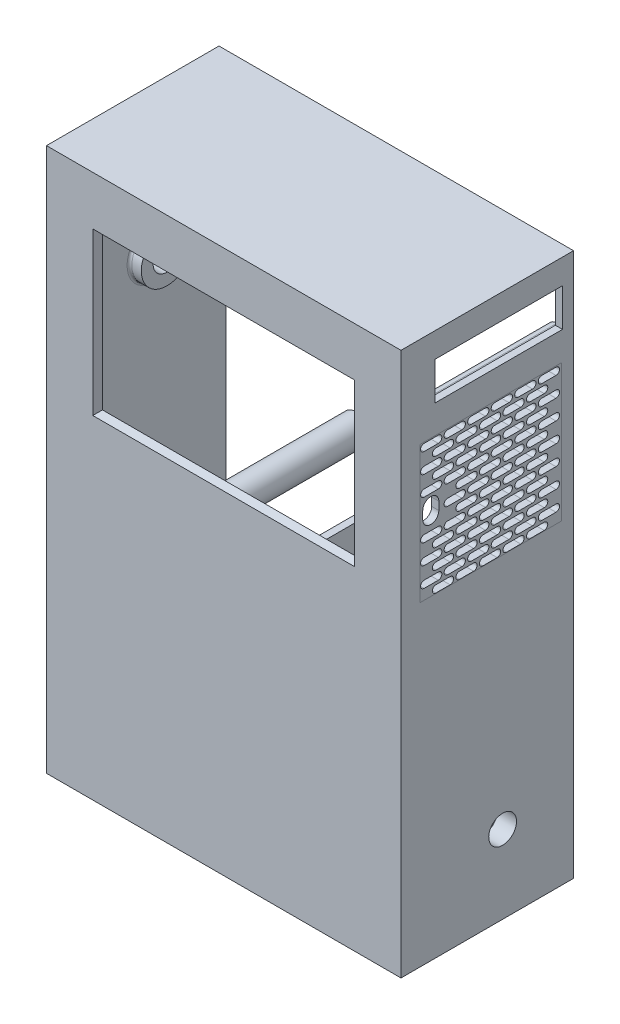
from build123d import *

# Parameters (mm, degrees)
SKETCH1_W                          = 150
SKETCH1_H                          = 230
OUTER_CASE_DEPTH                   = 73
CASE_THICKNESS_T                   = -3
SKETCH4_W                          = 108.6
SKETCH4_H                          = 66.2
DISPLAY_CUTOUT_DEPTH               = 155.110350074
DISPLAY_CUTOUT_TAPER               = -20
SKETCH5_W                          = 3
SKETCH5_H                          = 27.5
VALVE_SUPPORTER_DEPTH              = 30
SKETCH19_W                         = 2
SKETCH19_H                         = 27.5
VALVE_STOPPER_DEPTH                = 4.5
SKETCH7_R                          = 3.75
DISPLAY_MOUNT_DEPTH                = 6.2
DISPLAY_MOUNT_TAP_D                = 2.05
DISPLAY_MOUNT_TAP_DEPTH            = 5.7
DISPLAY_MOUNT_TAP_TIP              = 0.615882135
SKETCH13_R                         = 5.875
INLET_DEPTH                        = 201.40708587
INLET_START                        = 5
SKETCH14_R                         = 10.875
SKETCH14_R_2                       = 5.875
INLET_SUPPORT_DEPTH                = 5
SKETCH16_R                         = 3.5
RPI_MOUNT_DEPTH                    = 6
RPI_MOUNT_TAP_D                    = 2.05
RPI_MOUNT_TAP_DEPTH                = 5.5
RPI_MOUNT_TAP_TIP                  = 0.615882135
SKETCH18_W                         = 54
SKETCH18_H                         = 16
RPI_CUTOUT_DEPTH                   = 201.40708587
CUT_EXTRUDE1_REACH                 = 202.407
VENT_SEED_REACH                    = 204.618
VENT_START                         = 72
VENT_PATTERN_DEPTH                 = 3
SKETCH22_W                         = 15.5
SKETCH22_H                         = 21.9
LA_MOUNT_DEPTH                     = 24
LA_START                           = -3
SKETCH23_W                         = 24
SKETCH23_H                         = 21.9
LA_SLOT_DEPTH                      = 9.5
DISPLAY_SCREW_PASSTHROUGH_REACH    = 145.649
SKETCH24_R                         = 2.5
LA_PINHOLE_REACH                   = 145.649
SKETCH25_R                         = 2
LA_MOUNT_SUPPORT_REACH             = 156.11
LA_MOUNT_FILLET_R                  = 1
CORNER_START                       = -70
SKETCH26_W                         = 8
SKETCH26_H                         = 8
CORNER_SUPPORT_DEPTH               = 70
SKETCH40_R                         = 6
CETER_SUPPORT_DEPTH                = 70
SUPPORT_FILLET_R                   = 4
LA_SUPPORT_DEPTH                   = 10
TAP_DRILL_FOR_M2_5X0_45_TAP3_D     = 2.05
TAP_DRILL_FOR_M2_5X0_45_TAP3_DEPTH = 9.5
TAP_DRILL_FOR_M2_5X0_45_TAP3_TIP   = 0.615882135
SKETCH32_R                         = 5.875
OUTLET_DEPTH                       = 3
OUTLET_START                       = 5
SKETCH34_R                         = 10.875
SKETCH34_R_2                       = 5.875
OUTLET_SUPPORT_DEPTH               = 5
GENERAL_FILLET_R                   = 1
TAP_DRILL_FOR_M2_5X0_45_TAP5_D     = 2.05
TAP_DRILL_FOR_M2_5X0_45_TAP5_DEPTH = 30
TAP_DRILL_FOR_M2_5X0_45_TAP5_TIP   = 0.615882135


# Read off the part's stored shape, not the designer's step: Vent Pattern
# Some blends are built 0.0001 mm under size
with BuildPart() as part:
    # Sketch1 → Outer Case (new body)
    with BuildSketch(Plane.XY):
        Rectangle(SKETCH1_W, SKETCH1_H)
    extrude(amount=OUTER_CASE_DEPTH)

    # Case Thickness
    case_thickness_openings = [part.faces().sort_by_distance(p)[0] for p in [
        (0, 0, 0),
    ]]
    offset(amount=CASE_THICKNESS_T, openings=case_thickness_openings, kind=Kind.INTERSECTION)

    # Sketch4 → Display Cutout (cut, through all)
    with BuildSketch(Plane(origin=(0, 0, 70), x_dir=(-1, 0, 0), z_dir=(0, 0, -1))):
        with Locations((0, 60.1)):
            Rectangle(SKETCH4_W, SKETCH4_H)
    extrude(amount=-DISPLAY_CUTOUT_DEPTH, taper=DISPLAY_CUTOUT_TAPER, mode=Mode.SUBTRACT)

    # Sketch5 → Valve Supporter (add)
    with BuildSketch(Plane(origin=(0, 0, 70), x_dir=(-1, 0, 0), z_dir=(0, 0, -1))):
        with Locations((-48.5, -2.25)):
            Rectangle(SKETCH5_W, SKETCH5_H)
        with Locations((-23.5, -2.25)):
            Rectangle(SKETCH5_W, SKETCH5_H)
    extrude(amount=VALVE_SUPPORTER_DEPTH)

    # Sketch19 → Valve Stopper (add)
    with BuildSketch(Plane(origin=(0, 0, 70), x_dir=(-1, 0, 0), z_dir=(0, 0, -1))):
        with Locations((-66.5, -2.25)):
            Rectangle(SKETCH19_W, SKETCH19_H)
        with Locations((-41.5, -2.25)):
            Rectangle(SKETCH19_W, SKETCH19_H)
    extrude(amount=VALVE_STOPPER_DEPTH)

    # Sketch7 → Display Mount (add)
    with BuildSketch(Plane(origin=(0, 0, 70), x_dir=(-1, 0, 0), z_dir=(0, 0, -1))):
        with Locations(Location((-56.35, 99.9, 0), (0, 0, 180))):
            Circle(SKETCH7_R)
        with Locations(Location((56.35, 99.9, 0), (0, 0, 180))):
            Circle(SKETCH7_R)
        with Locations(Location((56.35, 16.1, 0), (0, 0, 180))):
            Circle(SKETCH7_R)
        with Locations(Location((-56.35, 16.1, 0), (0, 0, 180))):
            Circle(SKETCH7_R)
    extrude(amount=DISPLAY_MOUNT_DEPTH)

    # Display Mount Tap
    with Locations(Plane(origin=(56.35, 99.9, 63.8), x_dir=(-1, 0, 0), z_dir=(0, 0, -1))):
        with Locations((0, 0), (112.7, 0), (0, -83.8), (112.7, -83.8)):
            Hole(DISPLAY_MOUNT_TAP_D / 2, depth=DISPLAY_MOUNT_TAP_DEPTH)
            with Locations((0, 0, -(DISPLAY_MOUNT_TAP_DEPTH + DISPLAY_MOUNT_TAP_TIP / 2))):  # 118° drill point
                Cone(0, DISPLAY_MOUNT_TAP_D / 2, DISPLAY_MOUNT_TAP_TIP, mode=Mode.SUBTRACT)

    # Sketch13 → Inlet (cut, through all)
    with BuildSketch(Plane.ZY.offset(-72)):
        with Locations(Location((30, -82, 0), (0, 0, 270))):
            Circle(SKETCH13_R)
    extrude(amount=-INLET_DEPTH, mode=Mode.SUBTRACT)

    # Sketch14 → Inlet Support (add)
    with BuildSketch(Plane.ZY.offset(-72).offset(INLET_START)):
        with Locations((30, -82)):
            Circle(SKETCH14_R)
        with Locations((30, -82)):
            Circle(SKETCH14_R_2, mode=Mode.SUBTRACT)
    extrude(amount=-INLET_SUPPORT_DEPTH)

    # Sketch16 → RPi Mount (add)
    with BuildSketch(Plane.XZ.offset(-112)):
        with Locations(Location((47.5, 7, 0), (0, 0, 270))):
            Circle(SKETCH16_R)
        with Locations(Location((-10.5, 7, 0), (0, 0, 270))):
            Circle(SKETCH16_R)
        with Locations(Location((-10.5, 56, 0), (0, 0, 270))):
            Circle(SKETCH16_R)
        with Locations(Location((47.5, 56, 0), (0, 0, 270))):
            Circle(SKETCH16_R)
    extrude(amount=RPI_MOUNT_DEPTH)

    # RPi Mount Tap
    with Locations(Plane(origin=(47.5, 106, 7), x_dir=(0, 0, -1), z_dir=(0, -1, 0))):
        with Locations((0, 0), (-49, 0), (0, -58), (-49, -58)):
            Hole(RPI_MOUNT_TAP_D / 2, depth=RPI_MOUNT_TAP_DEPTH)
            with Locations((0, 0, -(RPI_MOUNT_TAP_DEPTH + RPI_MOUNT_TAP_TIP / 2))):  # 118° drill point
                Cone(0, RPI_MOUNT_TAP_D / 2, RPI_MOUNT_TAP_TIP, mode=Mode.SUBTRACT)

    # Sketch18 → RPi Cutout (cut, through all)
    with BuildSketch(Plane.ZY.offset(-72)):
        with Locations((31.675, 96.5)):
            Rectangle(SKETCH18_W, SKETCH18_H)
    extrude(amount=-RPI_CUTOUT_DEPTH, mode=Mode.SUBTRACT)

    # Sketch44 → Cut-Extrude1 (cut, up to next)
    with BuildSketch(Plane.ZY.offset(-72), mode=Mode.PRIVATE) as cut_extrude1_sk1:
        with BuildLine():
            Line((57, 48.3), (57, 51.7))
            ThreePointArc((57, 51.7), (60.4, 55.1), (63.8, 51.7))
            Line((63.8, 51.7), (63.8, 48.3))
            ThreePointArc((63.8, 48.3), (60.4, 44.9), (57, 48.3))
        make_face()
    cut_extrude1_tool1 = extrude(cut_extrude1_sk1.sketch, amount=-CUT_EXTRUDE1_REACH, mode=Mode.PRIVATE) & part.part
    add(cut_extrude1_tool1.solids().sort_by_distance((72, 50, 60.4))[0], mode=Mode.SUBTRACT)

    # Sketch21 → Vent Seed (cut, up to next)
    with BuildSketch(Plane(origin=(75, 0, 0), x_dir=(0, 0, -1), z_dir=(1, 0, 0)), mode=Mode.PRIVATE) as vent_seed_sk1:
        with BuildLine():
            Line((-63.21410267, 76.012960927), (-57.21410267, 76.012960927))
            ThreePointArc((-57.21410267, 76.012960927), (-55.71410267, 74.512960927), (-57.21410267, 73.012960927))
            Line((-57.21410267, 73.012960927), (-63.21410267, 73.012960927))
            ThreePointArc((-63.21410267, 73.012960927), (-64.71410267, 74.512960927), (-63.21410267, 76.012960927))
        make_face()
    vent_seed_tool1 = extrude(vent_seed_sk1.sketch, amount=-VENT_SEED_REACH, mode=Mode.PRIVATE) & part.part
    add(vent_seed_tool1.solids().sort_by_distance((75, 74.512961, 60.214103))[0], mode=Mode.SUBTRACT)

    # Vent Pattern outline → Vent Pattern (cut)
    with BuildSketch(Plane.YZ.offset(VENT_START)):
        with BuildLine():
            ThreePointArc((73.012960927, 47.25552491), (74.512960927, 45.75552491), (76.012960927, 47.25552491))
            Line((76.012960927, 47.25552491), (76.012960927, 53.25552491))
            ThreePointArc((76.012960927, 53.25552491), (74.512960927, 54.75552491), (73.012960927, 53.25552491))
            Line((73.012960927, 53.25552491), (73.012960927, 47.25552491))
        make_face()
        with BuildLine():
            ThreePointArc((73.012960927, 7.421213867), (74.512960927, 5.921213867), (76.012960927, 7.421213867))
            Line((76.012960927, 7.421213867), (76.012960927, 13.421213867))
            ThreePointArc((76.012960927, 13.421213867), (74.512960927, 14.921213867), (73.012960927, 13.421213867))
            Line((73.012960927, 13.421213867), (73.012960927, 7.421213867))
        make_face()
        with BuildLine():
            ThreePointArc((73.012960927, 27.338369388), (74.512960927, 25.838369388), (76.012960927, 27.338369388))
            Line((76.012960927, 27.338369388), (76.012960927, 33.338369388))
            ThreePointArc((76.012960927, 33.338369388), (74.512960927, 34.838369388), (73.012960927, 33.338369388))
            Line((73.012960927, 33.338369388), (73.012960927, 27.338369388))
        make_face()
        with BuildLine():
            ThreePointArc((73.012960927, 37.296947149), (74.512960927, 35.796947149), (76.012960927, 37.296947149))
            Line((76.012960927, 37.296947149), (76.012960927, 43.296947149))
            ThreePointArc((76.012960927, 43.296947149), (74.512960927, 44.796947149), (73.012960927, 43.296947149))
            Line((73.012960927, 43.296947149), (73.012960927, 37.296947149))
        make_face()
        with BuildLine():
            ThreePointArc((73.012960927, 17.379791628), (74.512960927, 15.879791628), (76.012960927, 17.379791628))
            Line((76.012960927, 17.379791628), (76.012960927, 23.379791628))
            ThreePointArc((76.012960927, 23.379791628), (74.512960927, 24.879791628), (73.012960927, 23.379791628))
            Line((73.012960927, 23.379791628), (73.012960927, 17.379791628))
        make_face()
        with BuildLine():
            Line((25.875527372, 27.338369388), (25.875527372, 33.338369388))
            ThreePointArc((25.875527372, 33.338369388), (24.375527372, 34.838369388), (22.875527372, 33.338369388))
            Line((22.875527372, 33.338369388), (22.875527372, 27.338369388))
            ThreePointArc((22.875527372, 27.338369388), (24.375527372, 25.838369388), (25.875527372, 27.338369388))
        make_face()
        with BuildLine():
            ThreePointArc((22.875527372, 7.421213867), (24.375527372, 5.921213867), (25.875527372, 7.421213867))
            Line((25.875527372, 7.421213867), (25.875527372, 13.421213867))
            ThreePointArc((25.875527372, 13.421213867), (24.375527372, 14.921213867), (22.875527372, 13.421213867))
            Line((22.875527372, 13.421213867), (22.875527372, 7.421213867))
        make_face()
        with BuildLine():
            ThreePointArc((22.875527372, 17.379791628), (24.375527372, 15.879791628), (25.875527372, 17.379791628))
            Line((25.875527372, 17.379791628), (25.875527372, 23.379791628))
            ThreePointArc((25.875527372, 23.379791628), (24.375527372, 24.879791628), (22.875527372, 23.379791628))
            Line((22.875527372, 23.379791628), (22.875527372, 17.379791628))
        make_face()
        with BuildLine():
            ThreePointArc((22.875527372, 47.25552491), (24.375527372, 45.75552491), (25.875527372, 47.25552491))
            Line((25.875527372, 47.25552491), (25.875527372, 53.25552491))
            ThreePointArc((25.875527372, 53.25552491), (24.375527372, 54.75552491), (22.875527372, 53.25552491))
            Line((22.875527372, 53.25552491), (22.875527372, 47.25552491))
        make_face()
        with BuildLine():
            ThreePointArc((22.875527372, 37.296947149), (24.375527372, 35.796947149), (25.875527372, 37.296947149))
            Line((25.875527372, 37.296947149), (25.875527372, 43.296947149))
            ThreePointArc((25.875527372, 43.296947149), (24.375527372, 44.796947149), (22.875527372, 43.296947149))
            Line((22.875527372, 43.296947149), (22.875527372, 37.296947149))
        make_face()
        with BuildLine():
            ThreePointArc((22.875527372, 57.21410267), (24.375527372, 55.71410267), (25.875527372, 57.21410267))
            Line((25.875527372, 57.21410267), (25.875527372, 63.21410267))
            ThreePointArc((25.875527372, 63.21410267), (24.375527372, 64.71410267), (22.875527372, 63.21410267))
            Line((22.875527372, 63.21410267), (22.875527372, 57.21410267))
        make_face()
        with BuildLine():
            Line((21.697407909, 32.317658269), (21.697407909, 38.317658269))
            ThreePointArc((21.697407909, 38.317658269), (20.197407909, 39.817658269), (18.697407909, 38.317658269))
            Line((18.697407909, 38.317658269), (18.697407909, 32.317658269))
            ThreePointArc((18.697407909, 32.317658269), (20.197407909, 30.817658269), (21.697407909, 32.317658269))
        make_face()
        with BuildLine():
            ThreePointArc((18.697407909, 12.400502748), (20.197407909, 10.900502748), (21.697407909, 12.400502748))
            Line((21.697407909, 12.400502748), (21.697407909, 18.400502748))
            ThreePointArc((21.697407909, 18.400502748), (20.197407909, 19.900502748), (18.697407909, 18.400502748))
            Line((18.697407909, 18.400502748), (18.697407909, 12.400502748))
        make_face()
        with BuildLine():
            ThreePointArc((18.697407909, 22.359080508), (20.197407909, 20.859080508), (21.697407909, 22.359080508))
            Line((21.697407909, 22.359080508), (21.697407909, 28.359080508))
            ThreePointArc((21.697407909, 28.359080508), (20.197407909, 29.859080508), (18.697407909, 28.359080508))
            Line((18.697407909, 28.359080508), (18.697407909, 22.359080508))
        make_face()
        with BuildLine():
            ThreePointArc((18.697407909, 52.23481379), (20.197407909, 50.73481379), (21.697407909, 52.23481379))
            Line((21.697407909, 52.23481379), (21.697407909, 58.23481379))
            ThreePointArc((21.697407909, 58.23481379), (20.197407909, 59.73481379), (18.697407909, 58.23481379))
            Line((18.697407909, 58.23481379), (18.697407909, 52.23481379))
        make_face()
        with BuildLine():
            ThreePointArc((18.697407909, 42.276236029), (20.197407909, 40.776236029), (21.697407909, 42.276236029))
            Line((21.697407909, 42.276236029), (21.697407909, 48.276236029))
            ThreePointArc((21.697407909, 48.276236029), (20.197407909, 49.776236029), (18.697407909, 48.276236029))
            Line((18.697407909, 48.276236029), (18.697407909, 42.276236029))
        make_face()
        with BuildLine():
            Line((34.231766298, 7.421213867), (34.231766298, 13.421213867))
            ThreePointArc((34.231766298, 13.421213867), (32.731766298, 14.921213867), (31.231766298, 13.421213867))
            Line((31.231766298, 13.421213867), (31.231766298, 7.421213867))
            ThreePointArc((31.231766298, 7.421213867), (32.731766298, 5.921213867), (34.231766298, 7.421213867))
        make_face()
        with BuildLine():
            ThreePointArc((31.231766298, 57.21410267), (32.731766298, 55.71410267), (34.231766298, 57.21410267))
            Line((34.231766298, 57.21410267), (34.231766298, 63.21410267))
            ThreePointArc((34.231766298, 63.21410267), (32.731766298, 64.71410267), (31.231766298, 63.21410267))
            Line((31.231766298, 63.21410267), (31.231766298, 57.21410267))
        make_face()
        with BuildLine():
            ThreePointArc((31.231766298, 37.296947149), (32.731766298, 35.796947149), (34.231766298, 37.296947149))
            Line((34.231766298, 37.296947149), (34.231766298, 43.296947149))
            ThreePointArc((34.231766298, 43.296947149), (32.731766298, 44.796947149), (31.231766298, 43.296947149))
            Line((31.231766298, 43.296947149), (31.231766298, 37.296947149))
        make_face()
        with BuildLine():
            ThreePointArc((31.231766298, 17.379791628), (32.731766298, 15.879791628), (34.231766298, 17.379791628))
            Line((34.231766298, 17.379791628), (34.231766298, 23.379791628))
            ThreePointArc((34.231766298, 23.379791628), (32.731766298, 24.879791628), (31.231766298, 23.379791628))
            Line((31.231766298, 23.379791628), (31.231766298, 17.379791628))
        make_face()
        with BuildLine():
            ThreePointArc((31.231766298, 27.338369388), (32.731766298, 25.838369388), (34.231766298, 27.338369388))
            Line((34.231766298, 27.338369388), (34.231766298, 33.338369388))
            ThreePointArc((34.231766298, 33.338369388), (32.731766298, 34.838369388), (31.231766298, 33.338369388))
            Line((31.231766298, 33.338369388), (31.231766298, 27.338369388))
        make_face()
        with BuildLine():
            ThreePointArc((31.231766298, 47.25552491), (32.731766298, 45.75552491), (34.231766298, 47.25552491))
            Line((34.231766298, 47.25552491), (34.231766298, 53.25552491))
            ThreePointArc((34.231766298, 53.25552491), (32.731766298, 54.75552491), (31.231766298, 53.25552491))
            Line((31.231766298, 53.25552491), (31.231766298, 47.25552491))
        make_face()
        with BuildLine():
            Line((30.053646835, 12.400502748), (30.053646835, 18.400502748))
            ThreePointArc((30.053646835, 18.400502748), (28.553646835, 19.900502748), (27.053646835, 18.400502748))
            Line((27.053646835, 18.400502748), (27.053646835, 12.400502748))
            ThreePointArc((27.053646835, 12.400502748), (28.553646835, 10.900502748), (30.053646835, 12.400502748))
        make_face()
        with BuildLine():
            ThreePointArc((27.053646835, 42.276236029), (28.553646835, 40.776236029), (30.053646835, 42.276236029))
            Line((30.053646835, 42.276236029), (30.053646835, 48.276236029))
            ThreePointArc((30.053646835, 48.276236029), (28.553646835, 49.776236029), (27.053646835, 48.276236029))
            Line((27.053646835, 48.276236029), (27.053646835, 42.276236029))
        make_face()
        with BuildLine():
            ThreePointArc((27.053646835, 22.359080508), (28.553646835, 20.859080508), (30.053646835, 22.359080508))
            Line((30.053646835, 22.359080508), (30.053646835, 28.359080508))
            ThreePointArc((30.053646835, 28.359080508), (28.553646835, 29.859080508), (27.053646835, 28.359080508))
            Line((27.053646835, 28.359080508), (27.053646835, 22.359080508))
        make_face()
        with BuildLine():
            ThreePointArc((27.053646835, 32.317658269), (28.553646835, 30.817658269), (30.053646835, 32.317658269))
            Line((30.053646835, 32.317658269), (30.053646835, 38.317658269))
            ThreePointArc((30.053646835, 38.317658269), (28.553646835, 39.817658269), (27.053646835, 38.317658269))
            Line((27.053646835, 38.317658269), (27.053646835, 32.317658269))
        make_face()
        with BuildLine():
            ThreePointArc((27.053646835, 52.23481379), (28.553646835, 50.73481379), (30.053646835, 52.23481379))
            Line((30.053646835, 52.23481379), (30.053646835, 58.23481379))
            ThreePointArc((30.053646835, 58.23481379), (28.553646835, 59.73481379), (27.053646835, 58.23481379))
            Line((27.053646835, 58.23481379), (27.053646835, 52.23481379))
        make_face()
        with BuildLine():
            Line((59.300483076, 37.296947149), (59.300483076, 43.296947149))
            ThreePointArc((59.300483076, 43.296947149), (57.800483076, 44.796947149), (56.300483076, 43.296947149))
            Line((56.300483076, 43.296947149), (56.300483076, 37.296947149))
            ThreePointArc((56.300483076, 37.296947149), (57.800483076, 35.796947149), (59.300483076, 37.296947149))
        make_face()
        with BuildLine():
            ThreePointArc((56.300483076, 27.338369388), (57.800483076, 25.838369388), (59.300483076, 27.338369388))
            Line((59.300483076, 27.338369388), (59.300483076, 33.338369388))
            ThreePointArc((59.300483076, 33.338369388), (57.800483076, 34.838369388), (56.300483076, 33.338369388))
            Line((56.300483076, 33.338369388), (56.300483076, 27.338369388))
        make_face()
        with BuildLine():
            ThreePointArc((56.300483076, 57.21410267), (57.800483076, 55.71410267), (59.300483076, 57.21410267))
            Line((59.300483076, 57.21410267), (59.300483076, 63.21410267))
            ThreePointArc((59.300483076, 63.21410267), (57.800483076, 64.71410267), (56.300483076, 63.21410267))
            Line((56.300483076, 63.21410267), (56.300483076, 57.21410267))
        make_face()
        with BuildLine():
            ThreePointArc((56.300483076, 47.25552491), (57.800483076, 45.75552491), (59.300483076, 47.25552491))
            Line((59.300483076, 47.25552491), (59.300483076, 53.25552491))
            ThreePointArc((59.300483076, 53.25552491), (57.800483076, 54.75552491), (56.300483076, 53.25552491))
            Line((56.300483076, 53.25552491), (56.300483076, 47.25552491))
        make_face()
        with BuildLine():
            ThreePointArc((56.300483076, 17.379791628), (57.800483076, 15.879791628), (59.300483076, 17.379791628))
            Line((59.300483076, 17.379791628), (59.300483076, 23.379791628))
            ThreePointArc((59.300483076, 23.379791628), (57.800483076, 24.879791628), (56.300483076, 23.379791628))
            Line((56.300483076, 23.379791628), (56.300483076, 17.379791628))
        make_face()
        with BuildLine():
            ThreePointArc((56.300483076, 7.421213867), (57.800483076, 5.921213867), (59.300483076, 7.421213867))
            Line((59.300483076, 7.421213867), (59.300483076, 13.421213867))
            ThreePointArc((59.300483076, 13.421213867), (57.800483076, 14.921213867), (56.300483076, 13.421213867))
            Line((56.300483076, 13.421213867), (56.300483076, 7.421213867))
        make_face()
        with BuildLine():
            Line((55.122363613, 42.276236029), (55.122363613, 48.276236029))
            ThreePointArc((55.122363613, 48.276236029), (53.622363613, 49.776236029), (52.122363613, 48.276236029))
            Line((52.122363613, 48.276236029), (52.122363613, 42.276236029))
            ThreePointArc((52.122363613, 42.276236029), (53.622363613, 40.776236029), (55.122363613, 42.276236029))
        make_face()
        with BuildLine():
            ThreePointArc((52.122363613, 32.317658269), (53.622363613, 30.817658269), (55.122363613, 32.317658269))
            Line((55.122363613, 32.317658269), (55.122363613, 38.317658269))
            ThreePointArc((55.122363613, 38.317658269), (53.622363613, 39.817658269), (52.122363613, 38.317658269))
            Line((52.122363613, 38.317658269), (52.122363613, 32.317658269))
        make_face()
        with BuildLine():
            ThreePointArc((52.122363613, 22.359080508), (53.622363613, 20.859080508), (55.122363613, 22.359080508))
            Line((55.122363613, 22.359080508), (55.122363613, 28.359080508))
            ThreePointArc((55.122363613, 28.359080508), (53.622363613, 29.859080508), (52.122363613, 28.359080508))
            Line((52.122363613, 28.359080508), (52.122363613, 22.359080508))
        make_face()
        with BuildLine():
            ThreePointArc((52.122363613, 12.400502748), (53.622363613, 10.900502748), (55.122363613, 12.400502748))
            Line((55.122363613, 12.400502748), (55.122363613, 18.400502748))
            ThreePointArc((55.122363613, 18.400502748), (53.622363613, 19.900502748), (52.122363613, 18.400502748))
            Line((52.122363613, 18.400502748), (52.122363613, 12.400502748))
        make_face()
        with BuildLine():
            Line((50.94424415, 47.25552491), (50.94424415, 53.25552491))
            ThreePointArc((50.94424415, 53.25552491), (49.44424415, 54.75552491), (47.94424415, 53.25552491))
            Line((47.94424415, 53.25552491), (47.94424415, 47.25552491))
            ThreePointArc((47.94424415, 47.25552491), (49.44424415, 45.75552491), (50.94424415, 47.25552491))
        make_face()
        with BuildLine():
            ThreePointArc((47.94424415, 37.296947149), (49.44424415, 35.796947149), (50.94424415, 37.296947149))
            Line((50.94424415, 37.296947149), (50.94424415, 43.296947149))
            ThreePointArc((50.94424415, 43.296947149), (49.44424415, 44.796947149), (47.94424415, 43.296947149))
            Line((47.94424415, 43.296947149), (47.94424415, 37.296947149))
        make_face()
        with BuildLine():
            ThreePointArc((47.94424415, 7.421213867), (49.44424415, 5.921213867), (50.94424415, 7.421213867))
            Line((50.94424415, 7.421213867), (50.94424415, 13.421213867))
            ThreePointArc((50.94424415, 13.421213867), (49.44424415, 14.921213867), (47.94424415, 13.421213867))
            Line((47.94424415, 13.421213867), (47.94424415, 7.421213867))
        make_face()
        with BuildLine():
            ThreePointArc((47.94424415, 27.338369388), (49.44424415, 25.838369388), (50.94424415, 27.338369388))
            Line((50.94424415, 27.338369388), (50.94424415, 33.338369388))
            ThreePointArc((50.94424415, 33.338369388), (49.44424415, 34.838369388), (47.94424415, 33.338369388))
            Line((47.94424415, 33.338369388), (47.94424415, 27.338369388))
        make_face()
        with BuildLine():
            ThreePointArc((47.94424415, 17.379791628), (49.44424415, 15.879791628), (50.94424415, 17.379791628))
            Line((50.94424415, 17.379791628), (50.94424415, 23.379791628))
            ThreePointArc((50.94424415, 23.379791628), (49.44424415, 24.879791628), (47.94424415, 23.379791628))
            Line((47.94424415, 23.379791628), (47.94424415, 17.379791628))
        make_face()
        with BuildLine():
            Line((42.588005224, 57.21410267), (42.588005224, 63.21410267))
            ThreePointArc((42.588005224, 63.21410267), (41.088005224, 64.71410267), (39.588005224, 63.21410267))
            Line((39.588005224, 63.21410267), (39.588005224, 57.21410267))
            ThreePointArc((39.588005224, 57.21410267), (41.088005224, 55.71410267), (42.588005224, 57.21410267))
        make_face()
        with BuildLine():
            ThreePointArc((39.588005224, 47.25552491), (41.088005224, 45.75552491), (42.588005224, 47.25552491))
            Line((42.588005224, 47.25552491), (42.588005224, 53.25552491))
            ThreePointArc((42.588005224, 53.25552491), (41.088005224, 54.75552491), (39.588005224, 53.25552491))
            Line((39.588005224, 53.25552491), (39.588005224, 47.25552491))
        make_face()
        with BuildLine():
            ThreePointArc((39.588005224, 17.379791628), (41.088005224, 15.879791628), (42.588005224, 17.379791628))
            Line((42.588005224, 17.379791628), (42.588005224, 23.379791628))
            ThreePointArc((42.588005224, 23.379791628), (41.088005224, 24.879791628), (39.588005224, 23.379791628))
            Line((39.588005224, 23.379791628), (39.588005224, 17.379791628))
        make_face()
        with BuildLine():
            ThreePointArc((39.588005224, 7.421213867), (41.088005224, 5.921213867), (42.588005224, 7.421213867))
            Line((42.588005224, 7.421213867), (42.588005224, 13.421213867))
            ThreePointArc((42.588005224, 13.421213867), (41.088005224, 14.921213867), (39.588005224, 13.421213867))
            Line((39.588005224, 13.421213867), (39.588005224, 7.421213867))
        make_face()
        with BuildLine():
            ThreePointArc((39.588005224, 37.296947149), (41.088005224, 35.796947149), (42.588005224, 37.296947149))
            Line((42.588005224, 37.296947149), (42.588005224, 43.296947149))
            ThreePointArc((42.588005224, 43.296947149), (41.088005224, 44.796947149), (39.588005224, 43.296947149))
            Line((39.588005224, 43.296947149), (39.588005224, 37.296947149))
        make_face()
        with BuildLine():
            ThreePointArc((39.588005224, 27.338369388), (41.088005224, 25.838369388), (42.588005224, 27.338369388))
            Line((42.588005224, 27.338369388), (42.588005224, 33.338369388))
            ThreePointArc((42.588005224, 33.338369388), (41.088005224, 34.838369388), (39.588005224, 33.338369388))
            Line((39.588005224, 33.338369388), (39.588005224, 27.338369388))
        make_face()
        with BuildLine():
            Line((71.834841464, 12.400502748), (71.834841464, 18.400502748))
            ThreePointArc((71.834841464, 18.400502748), (70.334841464, 19.900502748), (68.834841464, 18.400502748))
            Line((68.834841464, 18.400502748), (68.834841464, 12.400502748))
            ThreePointArc((68.834841464, 12.400502748), (70.334841464, 10.900502748), (71.834841464, 12.400502748))
        make_face()
        with BuildLine():
            ThreePointArc((68.834841464, 42.276236029), (70.334841464, 40.776236029), (71.834841464, 42.276236029))
            Line((71.834841464, 42.276236029), (71.834841464, 48.276236029))
            ThreePointArc((71.834841464, 48.276236029), (70.334841464, 49.776236029), (68.834841464, 48.276236029))
            Line((68.834841464, 48.276236029), (68.834841464, 42.276236029))
        make_face()
        with BuildLine():
            ThreePointArc((68.834841464, 52.23481379), (70.334841464, 50.73481379), (71.834841464, 52.23481379))
            Line((71.834841464, 52.23481379), (71.834841464, 58.23481379))
            ThreePointArc((71.834841464, 58.23481379), (70.334841464, 59.73481379), (68.834841464, 58.23481379))
            Line((68.834841464, 58.23481379), (68.834841464, 52.23481379))
        make_face()
        with BuildLine():
            ThreePointArc((68.834841464, 22.359080508), (70.334841464, 20.859080508), (71.834841464, 22.359080508))
            Line((71.834841464, 22.359080508), (71.834841464, 28.359080508))
            ThreePointArc((71.834841464, 28.359080508), (70.334841464, 29.859080508), (68.834841464, 28.359080508))
            Line((68.834841464, 28.359080508), (68.834841464, 22.359080508))
        make_face()
        with BuildLine():
            ThreePointArc((68.834841464, 32.317658269), (70.334841464, 30.817658269), (71.834841464, 32.317658269))
            Line((71.834841464, 32.317658269), (71.834841464, 38.317658269))
            ThreePointArc((71.834841464, 38.317658269), (70.334841464, 39.817658269), (68.834841464, 38.317658269))
            Line((68.834841464, 38.317658269), (68.834841464, 32.317658269))
        make_face()
        with BuildLine():
            Line((67.656722001, 17.379791628), (67.656722001, 23.379791628))
            ThreePointArc((67.656722001, 23.379791628), (66.156722001, 24.879791628), (64.656722001, 23.379791628))
            Line((64.656722001, 23.379791628), (64.656722001, 17.379791628))
            ThreePointArc((64.656722001, 17.379791628), (66.156722001, 15.879791628), (67.656722001, 17.379791628))
        make_face()
        with BuildLine():
            ThreePointArc((64.656722001, 7.421213867), (66.156722001, 5.921213867), (67.656722001, 7.421213867))
            Line((67.656722001, 7.421213867), (67.656722001, 13.421213867))
            ThreePointArc((67.656722001, 13.421213867), (66.156722001, 14.921213867), (64.656722001, 13.421213867))
            Line((64.656722001, 13.421213867), (64.656722001, 7.421213867))
        make_face()
        with BuildLine():
            ThreePointArc((64.656722001, 47.25552491), (66.156722001, 45.75552491), (67.656722001, 47.25552491))
            Line((67.656722001, 47.25552491), (67.656722001, 53.25552491))
            ThreePointArc((67.656722001, 53.25552491), (66.156722001, 54.75552491), (64.656722001, 53.25552491))
            Line((64.656722001, 53.25552491), (64.656722001, 47.25552491))
        make_face()
        with BuildLine():
            ThreePointArc((64.656722001, 57.21410267), (66.156722001, 55.71410267), (67.656722001, 57.21410267))
            Line((67.656722001, 57.21410267), (67.656722001, 63.21410267))
            ThreePointArc((67.656722001, 63.21410267), (66.156722001, 64.71410267), (64.656722001, 63.21410267))
            Line((64.656722001, 63.21410267), (64.656722001, 57.21410267))
        make_face()
        with BuildLine():
            ThreePointArc((64.656722001, 27.338369388), (66.156722001, 25.838369388), (67.656722001, 27.338369388))
            Line((67.656722001, 27.338369388), (67.656722001, 33.338369388))
            ThreePointArc((67.656722001, 33.338369388), (66.156722001, 34.838369388), (64.656722001, 33.338369388))
            Line((64.656722001, 33.338369388), (64.656722001, 27.338369388))
        make_face()
        with BuildLine():
            ThreePointArc((64.656722001, 37.296947149), (66.156722001, 35.796947149), (67.656722001, 37.296947149))
            Line((67.656722001, 37.296947149), (67.656722001, 43.296947149))
            ThreePointArc((67.656722001, 43.296947149), (66.156722001, 44.796947149), (64.656722001, 43.296947149))
            Line((64.656722001, 43.296947149), (64.656722001, 37.296947149))
        make_face()
        with BuildLine():
            Line((63.478602539, 22.359080508), (63.478602539, 28.359080508))
            ThreePointArc((63.478602539, 28.359080508), (61.978602539, 29.859080508), (60.478602539, 28.359080508))
            Line((60.478602539, 28.359080508), (60.478602539, 22.359080508))
            ThreePointArc((60.478602539, 22.359080508), (61.978602539, 20.859080508), (63.478602539, 22.359080508))
        make_face()
        with BuildLine():
            ThreePointArc((60.478602539, 52.23481379), (61.978602539, 50.73481379), (63.478602539, 52.23481379))
            Line((63.478602539, 52.23481379), (63.478602539, 58.23481379))
            ThreePointArc((63.478602539, 58.23481379), (61.978602539, 59.73481379), (60.478602539, 58.23481379))
            Line((60.478602539, 58.23481379), (60.478602539, 52.23481379))
        make_face()
        with BuildLine():
            ThreePointArc((60.478602539, 32.317658269), (61.978602539, 30.817658269), (63.478602539, 32.317658269))
            Line((63.478602539, 32.317658269), (63.478602539, 38.317658269))
            ThreePointArc((63.478602539, 38.317658269), (61.978602539, 39.817658269), (60.478602539, 38.317658269))
            Line((60.478602539, 38.317658269), (60.478602539, 32.317658269))
        make_face()
        with BuildLine():
            ThreePointArc((60.478602539, 42.276236029), (61.978602539, 40.776236029), (63.478602539, 42.276236029))
            Line((63.478602539, 42.276236029), (63.478602539, 48.276236029))
            ThreePointArc((63.478602539, 48.276236029), (61.978602539, 49.776236029), (60.478602539, 48.276236029))
            Line((60.478602539, 48.276236029), (60.478602539, 42.276236029))
        make_face()
        with BuildLine():
            ThreePointArc((60.478602539, 12.400502748), (61.978602539, 10.900502748), (63.478602539, 12.400502748))
            Line((63.478602539, 12.400502748), (63.478602539, 18.400502748))
            ThreePointArc((63.478602539, 18.400502748), (61.978602539, 19.900502748), (60.478602539, 18.400502748))
            Line((60.478602539, 18.400502748), (60.478602539, 12.400502748))
        make_face()
        with BuildLine():
            Line((38.409885761, 52.23481379), (38.409885761, 58.23481379))
            ThreePointArc((38.409885761, 58.23481379), (36.909885761, 59.73481379), (35.409885761, 58.23481379))
            Line((35.409885761, 58.23481379), (35.409885761, 52.23481379))
            ThreePointArc((35.409885761, 52.23481379), (36.909885761, 50.73481379), (38.409885761, 52.23481379))
        make_face()
        with BuildLine():
            ThreePointArc((35.409885761, 22.359080508), (36.909885761, 20.859080508), (38.409885761, 22.359080508))
            Line((38.409885761, 22.359080508), (38.409885761, 28.359080508))
            ThreePointArc((38.409885761, 28.359080508), (36.909885761, 29.859080508), (35.409885761, 28.359080508))
            Line((35.409885761, 28.359080508), (35.409885761, 22.359080508))
        make_face()
        with BuildLine():
            ThreePointArc((35.409885761, 12.400502748), (36.909885761, 10.900502748), (38.409885761, 12.400502748))
            Line((38.409885761, 12.400502748), (38.409885761, 18.400502748))
            ThreePointArc((38.409885761, 18.400502748), (36.909885761, 19.900502748), (35.409885761, 18.400502748))
            Line((35.409885761, 18.400502748), (35.409885761, 12.400502748))
        make_face()
        with BuildLine():
            ThreePointArc((35.409885761, 42.276236029), (36.909885761, 40.776236029), (38.409885761, 42.276236029))
            Line((38.409885761, 42.276236029), (38.409885761, 48.276236029))
            ThreePointArc((38.409885761, 48.276236029), (36.909885761, 49.776236029), (35.409885761, 48.276236029))
            Line((35.409885761, 48.276236029), (35.409885761, 42.276236029))
        make_face()
        with BuildLine():
            ThreePointArc((35.409885761, 32.317658269), (36.909885761, 30.817658269), (38.409885761, 32.317658269))
            Line((38.409885761, 32.317658269), (38.409885761, 38.317658269))
            ThreePointArc((38.409885761, 38.317658269), (36.909885761, 39.817658269), (35.409885761, 38.317658269))
            Line((35.409885761, 38.317658269), (35.409885761, 32.317658269))
        make_face()
        with BuildLine():
            Line((46.766124687, 42.276236029), (46.766124687, 48.276236029))
            ThreePointArc((46.766124687, 48.276236029), (45.266124687, 49.776236029), (43.766124687, 48.276236029))
            Line((43.766124687, 48.276236029), (43.766124687, 42.276236029))
            ThreePointArc((43.766124687, 42.276236029), (45.266124687, 40.776236029), (46.766124687, 42.276236029))
        make_face()
        with BuildLine():
            ThreePointArc((43.766124687, 12.400502748), (45.266124687, 10.900502748), (46.766124687, 12.400502748))
            Line((46.766124687, 12.400502748), (46.766124687, 18.400502748))
            ThreePointArc((46.766124687, 18.400502748), (45.266124687, 19.900502748), (43.766124687, 18.400502748))
            Line((43.766124687, 18.400502748), (43.766124687, 12.400502748))
        make_face()
        with BuildLine():
            ThreePointArc((43.766124687, 32.317658269), (45.266124687, 30.817658269), (46.766124687, 32.317658269))
            Line((46.766124687, 32.317658269), (46.766124687, 38.317658269))
            ThreePointArc((46.766124687, 38.317658269), (45.266124687, 39.817658269), (43.766124687, 38.317658269))
            Line((43.766124687, 38.317658269), (43.766124687, 32.317658269))
        make_face()
        with BuildLine():
            ThreePointArc((43.766124687, 22.359080508), (45.266124687, 20.859080508), (46.766124687, 22.359080508))
            Line((46.766124687, 22.359080508), (46.766124687, 28.359080508))
            ThreePointArc((46.766124687, 28.359080508), (45.266124687, 29.859080508), (43.766124687, 28.359080508))
            Line((43.766124687, 28.359080508), (43.766124687, 22.359080508))
        make_face()
    extrude(amount=VENT_PATTERN_DEPTH, mode=Mode.SUBTRACT)

    # Sketch22 → LA Mount (add)
    with BuildSketch(Plane(origin=(-72, 0, 0), x_dir=(0, 0, -1), z_dir=(1, 0, 0))):
        with Locations((-50, 101.05)):
            Rectangle(SKETCH22_W, SKETCH22_H)
    extrude(amount=LA_MOUNT_DEPTH)

    # Sketch23 → LA Slot (cut)
    with BuildSketch(Plane(origin=(0, 0, 42.25), x_dir=(-1, 0, 0), z_dir=(0, 0, -1)).offset(LA_START)):
        with Locations((60, 101.05)):
            Rectangle(SKETCH23_W, SKETCH23_H)
    extrude(amount=-LA_SLOT_DEPTH, mode=Mode.SUBTRACT)

    # Display Screw Passthrough: up to this face of the body (flat: up to its plane)
    display_screw_passthrough_end = Plane(part.part.faces().sort_by_distance((-60, 101.05, 57.75))[0])
    # Sketch24 → Display Screw Passthrough (cut, up to the picked face)
    with BuildSketch(Plane(origin=(0, 0, 42.25), x_dir=(-1, 0, 0), z_dir=(0, 0, -1)), mode=Mode.PRIVATE) as display_screw_passthrough_sk1:
        with Locations(Location((56.35, 99.9, 0), (0, 0, 90))):
            Circle(SKETCH24_R)
    display_screw_passthrough_tool1 = split(extrude(display_screw_passthrough_sk1.sketch, amount=-DISPLAY_SCREW_PASSTHROUGH_REACH, mode=Mode.PRIVATE), bisect_by=display_screw_passthrough_end, keep=Keep.BOTH, mode=Mode.PRIVATE)
    add(display_screw_passthrough_tool1.solids().sort_by(Axis((-56.35, 99.9, 42.25), (0, 0, 1)))[0], mode=Mode.SUBTRACT)

    # LA Pinhole: up to this face of the body (flat: up to its plane)
    la_pinhole_end = Plane(part.part.faces().sort_by_distance((-60.141645323, 101.094627979, 57.75))[0])
    # Sketch25 → LA Pinhole (cut, up to the picked face)
    with BuildSketch(Plane(origin=(0, 0, 42.25), x_dir=(-1, 0, 0), z_dir=(0, 0, -1)), mode=Mode.PRIVATE) as la_pinhole_sk1:
        with Locations(Location((52, 94.5, 0), (0, 0, 90))):
            Circle(SKETCH25_R)
    la_pinhole_tool1 = split(extrude(la_pinhole_sk1.sketch, amount=-LA_PINHOLE_REACH, mode=Mode.PRIVATE), bisect_by=la_pinhole_end, keep=Keep.BOTH, mode=Mode.PRIVATE)
    add(la_pinhole_tool1.solids().sort_by(Axis((-52, 94.5, 42.25), (0, 0, 1)))[0], mode=Mode.SUBTRACT)

    # Sketch28 → LA Mount Support (add, up to next)
    with BuildSketch(Plane(origin=(0, 0, 70), x_dir=(-1, 0, 0), z_dir=(0, 0, -1)), mode=Mode.PRIVATE) as la_mount_support_sk1:
        Polygon((72, 112), (48, 112), (48, 105.9), (62.35, 105.9), (62.35, 90.1), (72, 90.1), align=None)
    la_mount_support_tool1 = extrude(la_mount_support_sk1.sketch, amount=LA_MOUNT_SUPPORT_REACH, mode=Mode.PRIVATE) - part.part
    add(la_mount_support_tool1.solids().sort_by_distance((-63.660362, 103.363804, 70))[0])

    # LA Mount Fillet
    la_mount_fillet_edges = [part.edges().sort_by_distance(p)[0] for p in [
        (-72, 90.1, 62.375),
        (-55.175, 90.1, 57.75),
        (-48, 112, 43.75),
        (-48, 90.1, 56.25),
        (-48, 112, 62.375),
        (-48, 90.1, 43.75),
        (-72, 90.1, 43.75),
        (-48, 98, 57.75),
        (-55.175, 105.9, 57.75),
        (-62.35, 98, 57.75),
        (-62.35, 90.1, 63.875),
        (-62.35, 105.9, 63.875),
        (-48, 105.9, 63.875),
    ]]
    fillet(la_mount_fillet_edges, radius=LA_MOUNT_FILLET_R)

    # Sketch26 → Corner Support (add)
    with BuildSketch(Plane(origin=(0, 0, 0), x_dir=(-1, 0, 0), z_dir=(0, 0, -1)).offset(CORNER_START)):
        with Locations((68, 108)):
            Rectangle(SKETCH26_W, SKETCH26_H)
        with Locations((68, -108)):
            Rectangle(SKETCH26_W, SKETCH26_H)
        with Locations((-68, -108)):
            Rectangle(SKETCH26_W, SKETCH26_H)
        with Locations((-68, 81)):
            Rectangle(SKETCH26_W, SKETCH26_H)
    extrude(amount=CORNER_SUPPORT_DEPTH)

    # Sketch40 → Ceter Support (add)
    with BuildSketch(Plane(origin=(0, 0, 70), x_dir=(-1, 0, 0), z_dir=(0, 0, -1))):
        with Locations(Location((17, 4, 0), (0, 0, 180))):
            Circle(SKETCH40_R)
    extrude(amount=CETER_SUPPORT_DEPTH)

    # Support Fillet
    support_fillet_edges = [part.edges().sort_by_distance(p)[0] for p in [
        (-64, 104, 21.125),
        (-64, 104, 50),
        (-64, -104, 35),
        (64, -104, 35),
        (64, 77, 35),
        (64, 85, 35),
        (-23, 4, 70),
    ]]
    fillet(support_fillet_edges, radius=SUPPORT_FILLET_R - 0.0001)  # a hair under: the kernel refuses the full size

    # Sketch29 → LA Support (add)
    with BuildSketch(Plane(origin=(0, 0, 70), x_dir=(-1, 0, 0), z_dir=(0, 0, -1))):
        with BuildLine():
            Line((40.25, 10.5), (63.75, 10.5))
            ThreePointArc((63.75, 10.5), (69.75, 4.5), (63.75, -1.5))
            Line((63.75, -1.5), (40.25, -1.5))
            ThreePointArc((40.25, -1.5), (34.25, 4.5), (40.25, 10.5))
        make_face()
    extrude(amount=LA_SUPPORT_DEPTH)

    # Tap Drill for M2.5x0.45 Tap3
    with Locations(Plane(origin=(-40.25, 4.5, 60), x_dir=(-1, 0, 0), z_dir=(0, 0, -1))):
        with Locations((0, 0), (23.5, 0)):
            Hole(TAP_DRILL_FOR_M2_5X0_45_TAP3_D / 2, depth=TAP_DRILL_FOR_M2_5X0_45_TAP3_DEPTH)
            with Locations((0, 0, -(TAP_DRILL_FOR_M2_5X0_45_TAP3_DEPTH + TAP_DRILL_FOR_M2_5X0_45_TAP3_TIP / 2))):  # 118° drill point
                Cone(0, TAP_DRILL_FOR_M2_5X0_45_TAP3_D / 2, TAP_DRILL_FOR_M2_5X0_45_TAP3_TIP, mode=Mode.SUBTRACT)

    # Sketch32 → Outlet (cut)
    with BuildSketch(Plane(origin=(-72, 0, 0), x_dir=(0, 0, -1), z_dir=(1, 0, 0))):
        with Locations(Location((-30, 57, 0), (0, 0, 90))):
            Circle(SKETCH32_R)
    extrude(amount=-OUTLET_DEPTH, mode=Mode.SUBTRACT)

    # Sketch34 → Outlet Support (add)
    with BuildSketch(Plane(origin=(-72, 0, 0), x_dir=(0, 0, -1), z_dir=(1, 0, 0)).offset(OUTLET_START)):
        with Locations((-30, 57)):
            Circle(SKETCH34_R)
        with Locations((-30, 57)):
            Circle(SKETCH34_R_2, mode=Mode.SUBTRACT)
    extrude(amount=-OUTLET_SUPPORT_DEPTH)

    # General Fillet
    # the kernel refuses this fillet: 1 mm, written as the material it adds along each edge
    with BuildSketch(Plane(origin=(-56.35, 16.1, 70), x_dir=(1, 0, 0), z_dir=(0, 1, 0))) as general_fillet_piece_1:
        with BuildLine():
            CenterArc((3.75 + GENERAL_FILLET_R, GENERAL_FILLET_R), GENERAL_FILLET_R, 180, 90)
            Line((3.75, GENERAL_FILLET_R), (3.75, 0))
            Line((3.75, 0), (3.75 + GENERAL_FILLET_R, 0))
        make_face()
    revolve(axis=Axis((-56.35, 16.1, 70), (0, 0, -1)))
    with BuildSketch(Plane(origin=(72, -82, 30), x_dir=(0, 0, 1), z_dir=(0, -1, 0))) as general_fillet_piece_2:
        with BuildLine():
            CenterArc((10.875 + GENERAL_FILLET_R, GENERAL_FILLET_R), GENERAL_FILLET_R, 180, 90)
            Line((10.875, GENERAL_FILLET_R), (10.875, 0))
            Line((10.875, 0), (10.875 + GENERAL_FILLET_R, 0))
        make_face()
    revolve(axis=Axis((72, -82, 30), (-1, 0, 0)))
    with BuildSketch(Plane(origin=(47.5, 112, 7), x_dir=(0, 0, -1), z_dir=(-1, 0, 0))) as general_fillet_piece_3:
        with BuildLine():
            CenterArc((3.5 + GENERAL_FILLET_R, GENERAL_FILLET_R), GENERAL_FILLET_R, 180, 90)
            Line((3.5, GENERAL_FILLET_R), (3.5, 0))
            Line((3.5, 0), (3.5 + GENERAL_FILLET_R, 0))
        make_face()
    revolve(axis=Axis((47.5, 112, 7), (0, -1, 0)))
    with BuildSketch(Plane(origin=(-10.5, 112, 7), x_dir=(0, 0, -1), z_dir=(-1, 0, 0))) as general_fillet_piece_4:
        with BuildLine():
            CenterArc((3.5 + GENERAL_FILLET_R, GENERAL_FILLET_R), GENERAL_FILLET_R, 180, 90)
            Line((3.5, GENERAL_FILLET_R), (3.5, 0))
            Line((3.5, 0), (3.5 + GENERAL_FILLET_R, 0))
        make_face()
    revolve(axis=Axis((-10.5, 112, 7), (0, -1, 0)))
    with BuildSketch(Plane(origin=(-10.5, 112, 56), x_dir=(0, 0, -1), z_dir=(-1, 0, 0))) as general_fillet_piece_5:
        with BuildLine():
            CenterArc((3.5 + GENERAL_FILLET_R, GENERAL_FILLET_R), GENERAL_FILLET_R, 180, 90)
            Line((3.5, GENERAL_FILLET_R), (3.5, 0))
            Line((3.5, 0), (3.5 + GENERAL_FILLET_R, 0))
        make_face()
    revolve(axis=Axis((-10.5, 112, 56), (0, -1, 0)))
    with BuildSketch(Plane(origin=(47.5, 112, 56), x_dir=(0, 0, -1), z_dir=(-1, 0, 0))) as general_fillet_piece_6:
        with BuildLine():
            CenterArc((3.5 + GENERAL_FILLET_R, GENERAL_FILLET_R), GENERAL_FILLET_R, 180, 90)
            Line((3.5, GENERAL_FILLET_R), (3.5, 0))
            Line((3.5, 0), (3.5 + GENERAL_FILLET_R, 0))
        make_face()
    revolve(axis=Axis((47.5, 112, 56), (0, -1, 0)))
    with BuildSketch(Plane(origin=(-40.25, 4.5, 70), x_dir=(0, -1, 0), z_dir=(-1, 0, 0))) as general_fillet_piece_7:
        with BuildLine():
            CenterArc((6 + GENERAL_FILLET_R, -GENERAL_FILLET_R), GENERAL_FILLET_R, 90, 90)
            Line((6, -GENERAL_FILLET_R), (6, 0))
            Line((6, 0), (6 + GENERAL_FILLET_R, 0))
        make_face()
    revolve(axis=Axis((-40.25, 4.5, 70), (0, 0, 1)), revolution_arc=180)
    with BuildSketch(Plane(origin=(-63.75, -1.5, 70), x_dir=(0, -1, 0), z_dir=(1, 0, 0)), Plane(origin=(-40.25, 10.5, 70), x_dir=(0, 1, 0), z_dir=(-1, 0, 0))) as general_fillet_piece_8:
        with BuildLine():
            CenterArc((GENERAL_FILLET_R, GENERAL_FILLET_R), GENERAL_FILLET_R, 180, 90)
            Line((0, GENERAL_FILLET_R), (0, 0))
            Line((0, 0), (GENERAL_FILLET_R, 0))
        make_face()
    extrude(amount=23.5)
    with BuildSketch(Plane(origin=(-63.75, 4.5, 70), x_dir=(0, 1, 0), z_dir=(1, 0, 0))) as general_fillet_piece_9:
        with BuildLine():
            CenterArc((6 + GENERAL_FILLET_R, -GENERAL_FILLET_R), GENERAL_FILLET_R, 90, 90)
            Line((6, -GENERAL_FILLET_R), (6, 0))
            Line((6, 0), (6 + GENERAL_FILLET_R, 0))
        make_face()
    revolve(axis=Axis((-63.75, 4.5, 70), (0, 0, 1)), revolution_arc=180)
    with BuildSketch(Plane(origin=(-72, 57, 30), x_dir=(0, 0, -1), z_dir=(0, -1, 0))) as general_fillet_piece_10:
        with BuildLine():
            CenterArc((10.875 + GENERAL_FILLET_R, GENERAL_FILLET_R), GENERAL_FILLET_R, 180, 90)
            Line((10.875, GENERAL_FILLET_R), (10.875, 0))
            Line((10.875, 0), (10.875 + GENERAL_FILLET_R, 0))
        make_face()
    revolve(axis=Axis((-72, 57, 30), (1, 0, 0)))
    with BuildSketch(Plane(origin=(47, 11.5, 70), x_dir=(-1, 0, 0), z_dir=(0, -1, 0)), Plane(origin=(22, 11.5, 70), x_dir=(-1, 0, 0), z_dir=(0, -1, 0)), Plane(origin=(67.5, -16, 70), x_dir=(1, 0, 0), z_dir=(0, 1, 0)), Plane(origin=(42.5, -16, 70), x_dir=(1, 0, 0), z_dir=(0, 1, 0))) as general_fillet_piece_11:
        with BuildLine():
            CenterArc((GENERAL_FILLET_R, GENERAL_FILLET_R), GENERAL_FILLET_R, 180, 90)
            Line((0, GENERAL_FILLET_R), (0, 0))
            Line((0, 0), (GENERAL_FILLET_R, 0))
        make_face()
    extrude(amount=27.5)
    with BuildSketch(Plane(origin=(56.35, 99.9, 70), x_dir=(1, 0, 0), z_dir=(0, 1, 0))) as general_fillet_piece_12:
        with BuildLine():
            CenterArc((3.75 + GENERAL_FILLET_R, GENERAL_FILLET_R), GENERAL_FILLET_R, 180, 90)
            Line((3.75, GENERAL_FILLET_R), (3.75, 0))
            Line((3.75, 0), (3.75 + GENERAL_FILLET_R, 0))
        make_face()
    revolve(axis=Axis((56.35, 99.9, 70), (0, 0, -1)))
    with BuildSketch(Plane(origin=(56.35, 16.1, 70), x_dir=(1, 0, 0), z_dir=(0, 1, 0))) as general_fillet_piece_13:
        with BuildLine():
            CenterArc((3.75 + GENERAL_FILLET_R, GENERAL_FILLET_R), GENERAL_FILLET_R, 180, 90)
            Line((3.75, GENERAL_FILLET_R), (3.75, 0))
            Line((3.75, 0), (3.75 + GENERAL_FILLET_R, 0))
        make_face()
    revolve(axis=Axis((56.35, 16.1, 70), (0, 0, -1)))

    # Tap Drill for M2.5x0.45 Tap5
    with Locations(Plane(origin=(-68, 108, 0), x_dir=(-1, 0, 0), z_dir=(0, 0, -1))):
        with Locations((0, 0), (-136, -27), (-136, -216), (0, -216), (-51, -104)):
            Hole(TAP_DRILL_FOR_M2_5X0_45_TAP5_D / 2, depth=TAP_DRILL_FOR_M2_5X0_45_TAP5_DEPTH)
            with Locations((0, 0, -(TAP_DRILL_FOR_M2_5X0_45_TAP5_DEPTH + TAP_DRILL_FOR_M2_5X0_45_TAP5_TIP / 2))):  # 118° drill point
                Cone(0, TAP_DRILL_FOR_M2_5X0_45_TAP5_D / 2, TAP_DRILL_FOR_M2_5X0_45_TAP5_TIP, mode=Mode.SUBTRACT)


solid = part.part
